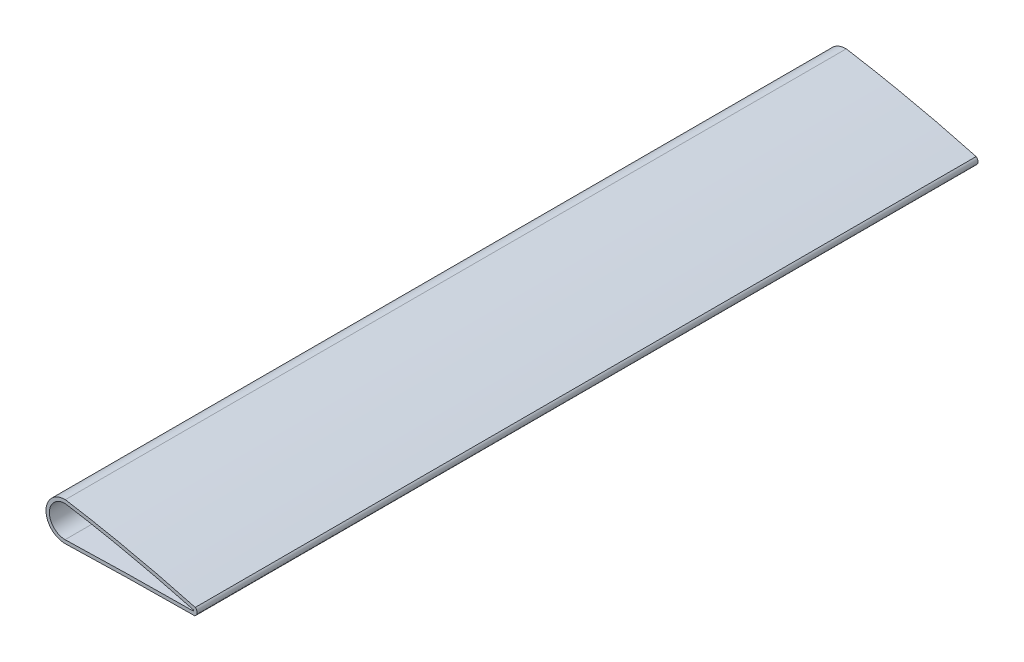
from build123d import *

# Parameters (mm, degrees)
THICKEN_START   = -455.6
THICKEN_1_DEPTH = 455.6


with BuildPart() as part:
    # Придать толщину1: read off the stored shape, not the designer's step
    # Придать толщину1 outline → Придать толщину1 (new body)
    with BuildSketch(Plane.XY.offset(THICKEN_START)):
        with BuildLine():
            add(Edge.make_bspline(
                [(251.038437909, 2.104989216), (250.259661586, 2.317295708), (249.480786416, 2.529251545), (247.921504391, 2.951590091), (247.141096874, 3.161970349), (245.578974469, 3.579852015), (244.797259065, 3.787351492), (243.233290735, 4.19934694), (242.451038042, 4.4038438), (240.103600277, 5.013460512), (238.537428407, 5.414788377), (235.402408081, 6.207214159), (233.833559481, 6.598311499), (229.123172024, 7.755774857), (225.977732493, 8.506327561), (219.677516471, 9.966479596), (216.522740375, 10.676080632), (210.204279031, 12.054333693), (207.040593857, 12.722986056), (200.70481892, 14.019192626), (197.532729162, 14.646746856), (191.180570801, 15.860634429), (188.000501962, 16.446966542), (181.632906291, 17.577598517), (178.445379467, 18.121898428), (175.254333297, 18.644787515)],
                knots=[0, 0, 0, 0, 2.421595334, 2.421595334, 4.846393511, 4.846393511, 7.272744833, 7.272744833, 9.698363515, 9.698363515, 14.548647375, 14.548647375, 19.399204532, 19.399204532, 29.100135903, 29.100135903, 38.800662961, 38.800662961, 48.501109829, 48.501109829, 58.201551176, 58.201551176, 67.902282314, 67.902282314, 77.603002554, 77.603002554, 77.603002554, 77.603002554], degree=3))
            add(Edge.make_bspline(
                [(175.254333297, 18.644787515), (175.21664915, 18.644715671), (175.178964056, 18.64476719), (175.098945433, 18.644810347), (175.056611904, 18.644793815), (174.922306692, 18.643921361), (174.83034001, 18.642103861), (174.554736955, 18.633266932), (174.371199203, 18.622866457), (174.005047201, 18.592999303), (173.822432233, 18.573541353), (173.458474586, 18.525690055), (173.277131282, 18.497301455), (172.916076644, 18.431661442), (172.736365133, 18.394410998), (172.378931579, 18.311119973), (172.201210172, 18.265076665), (171.848120004, 18.164256429), (171.672753074, 18.10947309), (171.32473953, 17.991224408), (171.152096362, 17.92774892), (170.810061241, 17.792198402), (170.640671963, 17.720116623), (170.305907709, 17.567697627), (170.140527954, 17.487370907), (169.814101145, 17.318724367), (169.653050016, 17.230412435), (169.335575197, 17.046022678), (169.179149017, 16.949949141), (168.871220855, 16.750253547), (168.719718231, 16.646632481), (168.421940034, 16.432047269), (168.275665956, 16.321081047), (167.988656947, 16.09200079), (167.84792599, 15.973881775), (167.572322299, 15.730686883), (167.437456419, 15.605603237), (167.174054402, 15.348776899), (167.045522321, 15.217030046), (166.795334316, 14.947476488), (166.673669818, 14.809677739), (166.437405991, 14.528373303), (166.322800117, 14.384873113), (166.100840316, 14.092486145), (165.993482702, 13.943602166), (165.786212322, 13.64075957), (165.686298867, 13.486801426), (165.494119812, 13.174114258), (165.401856712, 13.015383698), (165.22519367, 12.69345001), (165.140799679, 12.530243617), (164.980098613, 12.199655397), (164.903801277, 12.032268834), (164.759625906, 11.693801728), (164.691752408, 11.522719252), (164.564683244, 11.177613361), (164.505476496, 11.003594025), (164.395778445, 10.653005268), (164.345279218, 10.476438327), (164.253045767, 10.12112208), (164.21130728, 9.942373881), (164.136654403, 9.583057267), (164.103739399, 9.402488979), (164.046805091, 9.039890783), (164.02278888, 8.857860389), (163.983737143, 8.492696367), (163.968708556, 8.309561996), (163.947726174, 7.942550622), (163.941783377, 7.758672988), (163.939093328, 7.390776136), (163.942349778, 7.206756891), (163.957997798, 6.83934864), (163.970377461, 6.655959126), (164.004159262, 6.290179535), (164.025553299, 6.107788709), (164.077269214, 5.744365049), (164.10758689, 5.563331618), (164.177066971, 5.202979958), (164.216228912, 5.02366164), (164.303327199, 4.667099119), (164.351266738, 4.489855695), (164.455862069, 4.137806861), (164.512524708, 3.963003485), (164.634516544, 3.616204689), (164.699856304, 3.444212982), (164.839069543, 3.103666417), (164.912945229, 2.935112461), (165.068879525, 2.602102832), (165.15092733, 2.437642097), (165.322964121, 2.1131133), (165.412946085, 1.953041516), (165.600626681, 1.637585238), (165.698321833, 1.482198673), (165.901215823, 1.17641088), (166.006414439, 1.026009505), (166.224113313, 0.730496649), (166.336616395, 0.585387249), (166.568731112, 0.300771963), (166.688348468, 0.161270742), (166.934504929, -0.111804848), (167.061052545, -0.245371547), (167.320681501, -0.506030119), (167.45376367, -0.633121167), (167.725901226, -0.880380985), (167.864948842, -1.00055831), (168.148685162, -1.233810124), (168.293369093, -1.346890418), (168.588058744, -1.565760139), (168.738062282, -1.671552506), (169.043081447, -1.875650043), (169.198097124, -1.973955139), (169.512838275, -2.162871253), (169.672565728, -2.253478976), (169.996432606, -2.426781697), (170.160575668, -2.509469897), (170.492978365, -2.666701774), (170.661243043, -2.741234791), (171.001280721, -2.881784135), (171.173053511, -2.947800971), (171.519438301, -3.071139458), (171.694046293, -3.128472372), (172.045726489, -3.234405464), (172.222796436, -3.283013138), (172.579033487, -3.371448279), (172.758199647, -3.41127955), (173.118268107, -3.482102534), (173.299170383, -3.513094366), (173.66235267, -3.566168805), (173.84463321, -3.588247781), (174.210214508, -3.623407889), (174.393515989, -3.636481493), (174.758523565, -3.653449821), (174.940225051, -3.657443852), (175.121916309, -3.656966802)],
                knots=[0, 0, 0, 0, 0.113054335, 0.113054335, 0.240053862, 0.240053862, 0.515979404, 0.515979404, 1.067235955, 1.067235955, 1.617962231, 1.617962231, 2.16839612, 2.16839612, 2.718769816, 2.718769816, 3.26931446, 3.26931446, 3.820264816, 3.820264816, 4.371863846, 4.371863846, 4.923898444, 4.923898444, 5.475238816, 5.475238816, 6.026040458, 6.026040458, 6.57653979, 6.57653979, 7.126966875, 7.126966875, 7.677550177, 7.677550177, 8.228521348, 8.228521348, 8.780119938, 8.780119938, 9.332067271, 9.332067271, 9.883309525, 9.883309525, 10.434032648, 10.434032648, 10.984473518, 10.984473518, 11.534863341, 11.534863341, 12.085432332, 12.085432332, 12.636414435, 12.636414435, 13.188051933, 13.188051933, 13.739985339, 13.739985339, 14.291206709, 14.291206709, 14.841923688, 14.841923688, 15.392372129, 15.392372129, 15.942782317, 15.942782317, 16.493383694, 16.493383694, 17.044409616, 17.044409616, 17.596101988, 17.596101988, 18.148016502, 18.148016502, 18.69921203, 18.69921203, 19.249913265, 19.249913265, 19.800355596, 19.800355596, 20.350769121, 20.350769121, 20.901383385, 20.901383385, 21.452432129, 21.452432129, 22.004157915, 22.004157915, 22.556026635, 22.556026635, 23.107175076, 23.107175076, 23.657840526, 23.657840526, 24.208258899, 24.208258899, 24.758661018, 24.758661018, 25.309277308, 25.309277308, 25.860342508, 25.860342508, 26.412100263, 26.412100263, 26.963928118, 26.963928118, 27.515057736, 27.515057736, 28.065730364, 28.065730364, 28.616179486, 28.616179486, 29.166634005, 29.166634005, 29.71732302, 29.71732302, 30.268480605, 30.268480605, 30.820350253, 30.820350253, 31.372186921, 31.372186921, 31.923301585, 31.923301585, 32.473940441, 32.473940441, 33.024340189, 33.024340189, 33.574732548, 33.574732548, 34.125348918, 34.125348918, 34.676425048, 34.676425048, 35.221444185, 35.221444185, 35.221444185, 35.221444185], degree=3))
            add(Edge.make_bspline(
                [(175.121916309, -3.656966802), (178.275518133, -3.560465465), (181.429273712, -3.468928362), (187.736964048, -3.296238936), (190.890898796, -3.215086267), (197.199018457, -3.063615791), (200.353203369, -2.993297949), (206.661861206, -2.863152248), (209.816334134, -2.803324629), (216.125558681, -2.693813889), (219.280310306, -2.644131099), (225.590079078, -2.554306059), (228.745096231, -2.514164202), (235.055524363, -2.442748278), (238.210935351, -2.411475042), (244.522335503, -2.355715738), (247.678324677, -2.331230785), (250.834325348, -2.309101777)],
                knots=[0, 0, 0, 0, 9.465232833, 9.465232833, 18.930151133, 18.930151133, 28.3950386, 28.3950386, 37.860142364, 37.860142364, 47.325555536, 47.325555536, 56.791358839, 56.791358839, 66.258048205, 66.258048205, 75.726289909, 75.726289909, 75.726289909, 75.726289909], degree=3))
            add(Edge.make_bspline(
                [(250.834325348, -2.309101777), (250.894760566, -2.248664895), (250.955197001, -2.188229292), (251.076069872, -2.067358085), (251.136506307, -2.006922482), (251.227159134, -1.916267159), (251.257376439, -1.886048398), (251.302705134, -1.840723134), (251.317815156, -1.825615193), (251.348030026, -1.795393874), (251.363134875, -1.780280497), (251.385806983, -1.757626019), (251.393366824, -1.750077124), (251.422579532, -1.72079929), (251.444134311, -1.698967283), (251.485402511, -1.655295295), (251.505155206, -1.633492637), (251.543823766, -1.589301824), (251.562742429, -1.566916105), (251.599705829, -1.52153058), (251.617752728, -1.498532539), (251.652986228, -1.451943491), (251.670174126, -1.428353463), (251.703686987, -1.380584806), (251.720012357, -1.356406462), (251.751798596, -1.307467068), (251.767258931, -1.28270567), (251.797309533, -1.232603333), (251.811898282, -1.207261483), (251.840197123, -1.156000476), (251.853904679, -1.130079918), (251.880428933, -1.077663033), (251.893242046, -1.05116489), (251.917961572, -0.997594375), (251.929863331, -0.970519854), (251.952684577, -0.915932013), (251.963603193, -0.888418328), (251.984381046, -0.833150444), (251.994245296, -0.80539813), (252.012926995, -0.74966734), (252.021748488, -0.72169022), (252.038355152, -0.665519974), (252.046143306, -0.63732773), (252.06069082, -0.580735056), (252.06745207, -0.552335111), (252.079950072, -0.495333095), (252.085687591, -0.466731192), (252.096139007, -0.409330145), (252.100852527, -0.380530933), (252.109253257, -0.322739581), (252.112938935, -0.293747219), (252.119277662, -0.235573915), (252.121928014, -0.20639268), (252.126186127, -0.147846646), (252.127790028, -0.118481567), (252.129941687, -0.059574151), (252.130484432, -0.03003163), (252.130496717, 0.029057719), (252.129966109, 0.058604546), (252.127838161, 0.117524161), (252.12624572, 0.146897125), (252.122009685, 0.205461123), (252.119369886, 0.23465243), (252.113051344, 0.292846717), (252.109375279, 0.321849987), (252.100992975, 0.379662677), (252.096288295, 0.408472323), (252.08585407, 0.465892502), (252.080124971, 0.494503117), (252.067643814, 0.551519631), (252.0608911, 0.579925388), (252.046361328, 0.636525663), (252.038582532, 0.664719734), (252.021996092, 0.720888608), (252.013185654, 0.748862587), (251.994528562, 0.804581184), (251.984678095, 0.832324526), (251.963931313, 0.887568173), (251.953030244, 0.915066692), (251.930245157, 0.969625832), (251.918361987, 0.996686806), (251.893680343, 1.050232301), (251.880886483, 1.076718949), (251.854400955, 1.129115574), (251.840712811, 1.155027332), (251.812452455, 1.206274031), (251.797882698, 1.231610326), (251.767869113, 1.2817053), (251.752426705, 1.306464829), (251.720674693, 1.355404617), (251.704365509, 1.379585148), (251.6708826, 1.427362492), (251.653708339, 1.45095893), (251.618499209, 1.49756555), (251.600462902, 1.520574647), (251.563515972, 1.565986017), (251.544603029, 1.588386398), (251.505944257, 1.632614203), (251.486195482, 1.654439067), (251.444713761, 1.698364834), (251.422931157, 1.72041853), (251.385971122, 1.757509391), (251.370843256, 1.772598597), (251.340610872, 1.802801525), (251.325506355, 1.817915247), (251.280187415, 1.863250755), (251.249967605, 1.893466884), (251.159302784, 1.984109613), (251.098852385, 2.044530556), (251.038437909, 2.104989216)],
                knots=[0, 0, 0, 0, 0.256408358, 0.256408358, 0.512816716, 0.512816716, 0.641020894, 0.641020894, 0.705122984, 0.705122984, 0.769225073, 0.769225073, 0.801276118, 0.801276118, 0.893298827, 0.893298827, 0.981533454, 0.981533454, 1.069445007, 1.069445007, 1.157125944, 1.157125944, 1.244670274, 1.244670274, 1.332172908, 1.332172908, 1.419729036, 1.419729036, 1.507433501, 1.507433501, 1.595380172, 1.595380172, 1.683661293, 1.683661293, 1.772366793, 1.772366793, 1.861150173, 1.861150173, 1.949490702, 1.949490702, 2.037476499, 2.037476499, 2.125202348, 2.125202348, 2.212764738, 2.212764738, 2.300261213, 2.300261213, 2.387789737, 2.387789737, 2.475448084, 2.475448084, 2.563333209, 2.563333209, 2.65154061, 2.65154061, 2.740163642, 2.740163642, 2.82879892, 2.82879892, 2.917028056, 2.917028056, 3.004940396, 3.004940396, 3.092627549, 3.092627549, 3.180182664, 3.180182664, 3.267699779, 3.267699779, 3.355273195, 3.355273195, 3.442996854, 3.442996854, 3.530963706, 3.530963706, 3.619265055, 3.619265055, 3.707986782, 3.707986782, 3.796632687, 3.796632687, 3.884857668, 3.884857668, 3.972753826, 3.972753826, 4.06041546, 4.06041546, 4.147938391, 4.147938391, 4.235419306, 4.235419306, 4.322955139, 4.322955139, 4.410642455, 4.410642455, 4.498576819, 4.498576819, 4.586852144, 4.586852144, 4.679828962, 4.679828962, 4.743931052, 4.743931052, 4.808033141, 4.808033141, 4.93623732, 4.93623732, 5.192645678, 5.192645678, 5.192645678, 5.192645678], degree=3))
        make_face()
        with BuildLine():
            add(Edge.make_bspline(
                [(175.09133409, 16.644787515), (173.893487081, 16.644787515), (171.498250991, 16.168885997), (168.451963496, 14.133063474), (166.416633147, 11.087146564), (165.701897128, 7.493910357), (166.416633147, 3.900674149), (168.451963496, 0.85475724), (171.498250991, -1.181065284), (173.893487081, -1.656966802), (175.09133409, -1.656966802)],
                knots=[0, 0, 0, 0, 0.019845816, 0.039691633, 0.059537449, 0.079383266, 0.099229082, 0.119074899, 0.138920715, 0.158766531, 0.158766531, 0.158766531, 0.158766531], degree=3))
            add(Edge.make_bspline(
                [(250, 0.315), (248.458226877, 0.735022294), (245.373518657, 1.570889868), (239.191034041, 3.19348281), (231.443684348, 5.147868174), (222.116639882, 7.369220356), (209.643271081, 10.17087126), (193.986378508, 13.371996338), (181.398847462, 15.609793216), (175.09133409, 16.644787515)],
                knots=[0.576400931, 0.576400931, 0.576400931, 0.576400931, 0.602875873, 0.629350814, 0.682300698, 0.735250582, 0.788200465, 0.894100233, 1, 1, 1, 1], degree=3))
            add(Edge.make_bspline(
                [(250, -0.315), (250.041233403, -0.273766597), (250.10731144, -0.174930354), (250.142081841, 4.6556e-05), (250.107304956, 0.174904085), (250.041233403, 0.273766597), (250, 0.315)],
                knots=[0.572536444, 0.572536444, 0.572536444, 0.572536444, 0.573502566, 0.574468687, 0.575434809, 0.576400931, 0.576400931, 0.576400931, 0.576400931], degree=3))
            add(Edge.make_bspline(
                [(175.09133409, -1.656966802), (181.331961037, -1.466069952), (193.814413866, -1.123105552), (212.54114828, -0.735849718), (231.269964875, -0.467984983), (243.756613941, -0.359517778), (250, -0.315)],
                knots=[0.158766531, 0.158766531, 0.158766531, 0.158766531, 0.26220901, 0.365651488, 0.469093966, 0.572536444, 0.572536444, 0.572536444, 0.572536444], degree=3))
        make_face(mode=Mode.SUBTRACT)
    extrude(amount=THICKEN_1_DEPTH)


solid = part.part
